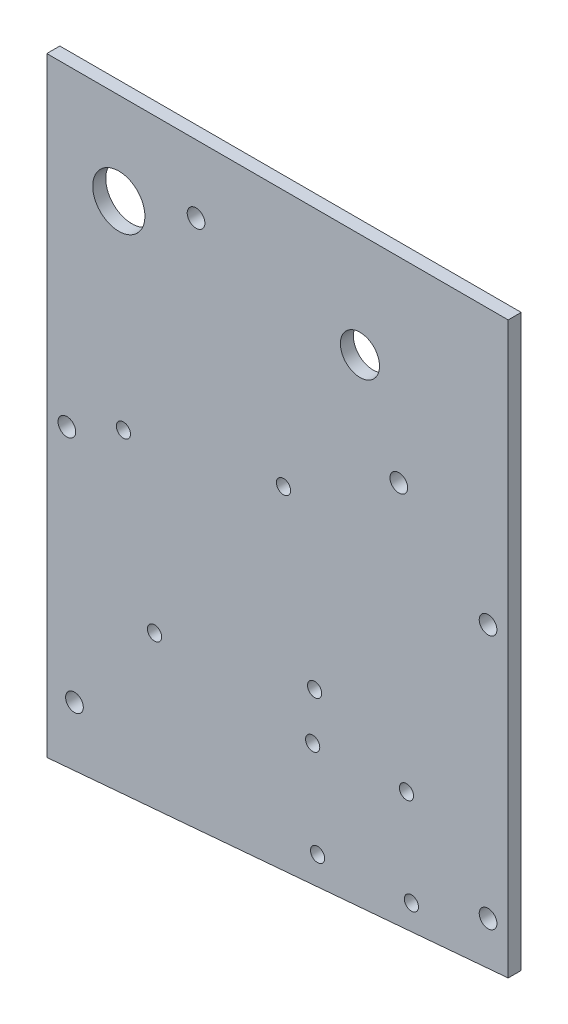
from build123d import *

# Parameters (mm, degrees)
BOSS_EXTRUDE1_DEPTH          = 3.175
F_6_CLEARANCE_HOLE1_D        = 4.3053
F_4_CLEARANCE_HOLE1_D        = 3.4544
F_6_CLEARANCE_HOLE2_D        = 4.3053
F_3_8_0_375_DIAMETER_HOLE1_D = 9.525
F_1_2_0_5_DIAMETER_HOLE1_D   = 12.7


with BuildPart() as part:
    # Sketch1 → Boss-Extrude1 (new body)
    with BuildSketch(Plane.XY):
        Polygon((112.268, 0), (0, 0), (0, -148.336), (112.268, -138.684), align=None)
    extrude(amount=-BOSS_EXTRUDE1_DEPTH)

    # #6 Clearance Hole1 (through all)
    with Locations(Plane.XY):
        with Locations((6.731, -133.35), (107.3785, -128.5875), (107.3785, -66.675), (4.8895, -76.2)):
            Hole(F_6_CLEARANCE_HOLE1_D / 2)

    # #4 Clearance Hole1 (through all)
    with Locations(Plane.XY):
        with Locations((18.644469576, -70.03220158), (57.60279842, -62.459469576), (65.175530424, -101.41779842), (26.21720158, -108.990530424), (65.891864398, -135.837535562), (88.720535562, -134.641135602), (87.524135602, -111.812464438), (64.695464438, -113.008864398)):
            Hole(F_4_CLEARANCE_HOLE1_D / 2)

    # #6 Clearance Hole2 (through all)
    with Locations(Plane.XY):
        with Locations((36.322, -16.51), (85.6615, -47.625)):
            Hole(F_6_CLEARANCE_HOLE2_D / 2)

    # 3/8 (0.375) Diameter Hole1 (through all)
    with Locations(Plane.XY):
        with Locations((76.2, -25.4)):
            Hole(F_3_8_0_375_DIAMETER_HOLE1_D / 2)

    # 1/2 (0.5) Diameter Hole1 (through all)
    with Locations(Plane.XY):
        with Locations((17.526, -22.352)):
            Hole(F_1_2_0_5_DIAMETER_HOLE1_D / 2)


solid = part.part
